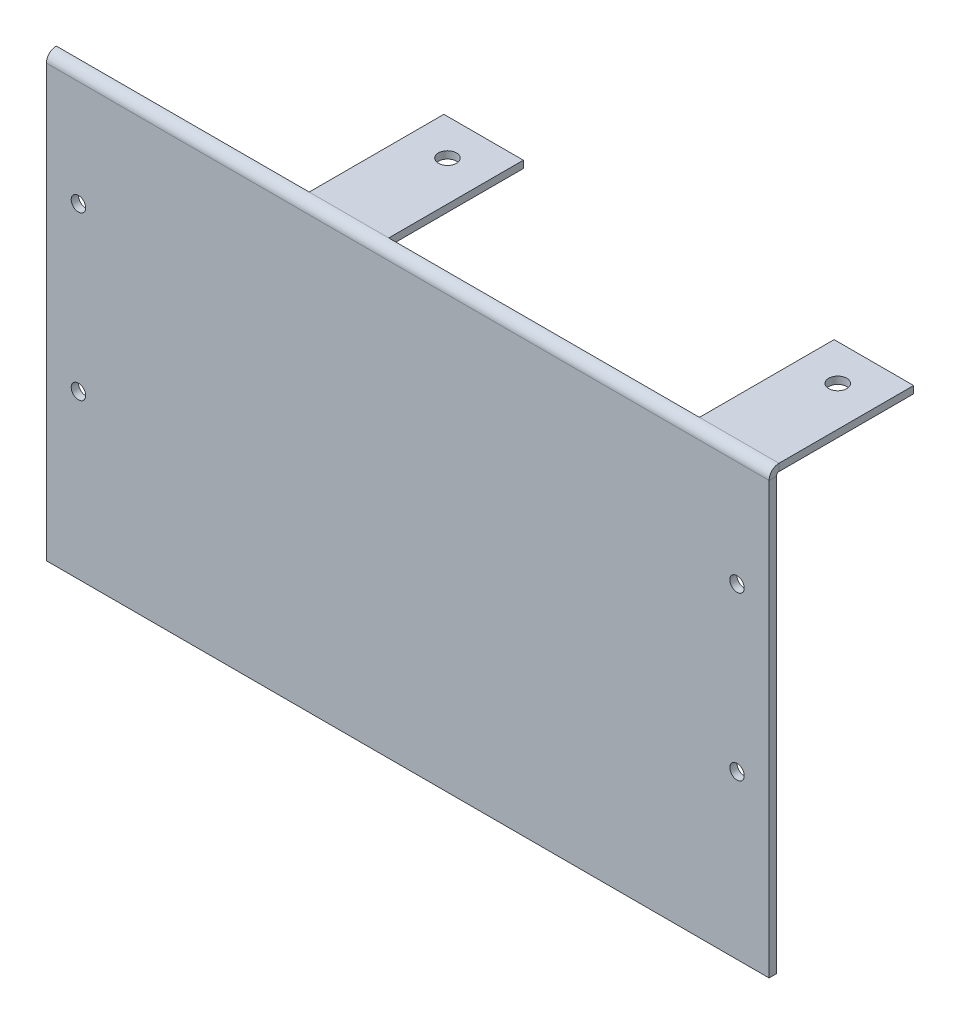
from build123d import *

# Parameters (mm, degrees)
SKETCH2_W                    = 200
SKETCH2_H                    = 120
BASE_FLANGE1_DEPTH           = 2
CUT_EXTRUDE1_REACH           = 235.247
SKETCH7_R                    = 2
EDGE_FLANGE1_STRIP_W         = 9.4732
EDGE_FLANGE1_STRIP_H         = 2
EDGE_FLANGE1_STRIP_CUT_DEPTH = 200
EDGE_FLANGE1_DEPTH           = 200
CUT_EXTRUDE2_REACH           = 239.664
SKETCH11_R                   = 2.5
SKETCH11_W                   = 86
SKETCH11_H                   = 37.2634
SKETCH11_W_2                 = 70


# Sheet-metal steps are written as plain solids
with BuildPart() as part:
    # Sketch2 → Base-Flange1 (new body)
    with BuildSketch(Plane.XY):
        with Locations((100, 60)):
            Rectangle(SKETCH2_W, SKETCH2_H)
    extrude(amount=-BASE_FLANGE1_DEPTH)

    # Sketch7 → Cut-Extrude1 (cut, up to next)
    with BuildSketch(Plane.XY, mode=Mode.PRIVATE) as cut_extrude1_sk1:
        with Locations((8.87, 90)):
            Circle(SKETCH7_R)
    cut_extrude1_tool1 = extrude(cut_extrude1_sk1.sketch, amount=-CUT_EXTRUDE1_REACH, mode=Mode.PRIVATE) & part.part
    # Sketch7 → Cut-Extrude1 (cut, up to next)
    with BuildSketch(Plane.XY, mode=Mode.PRIVATE) as cut_extrude1_sk2:
        with Locations((8.87, 45)):
            Circle(SKETCH7_R)
    cut_extrude1_tool2 = extrude(cut_extrude1_sk2.sketch, amount=-CUT_EXTRUDE1_REACH, mode=Mode.PRIVATE) & part.part
    # Sketch7 → Cut-Extrude1 (cut, up to next)
    with BuildSketch(Plane.XY, mode=Mode.PRIVATE) as cut_extrude1_sk3:
        with Locations((191.13, 45)):
            Circle(SKETCH7_R)
    cut_extrude1_tool3 = extrude(cut_extrude1_sk3.sketch, amount=-CUT_EXTRUDE1_REACH, mode=Mode.PRIVATE) & part.part
    # Sketch7 → Cut-Extrude1 (cut, up to next)
    with BuildSketch(Plane.XY, mode=Mode.PRIVATE) as cut_extrude1_sk4:
        with Locations((191.13, 90)):
            Circle(SKETCH7_R)
    cut_extrude1_tool4 = extrude(cut_extrude1_sk4.sketch, amount=-CUT_EXTRUDE1_REACH, mode=Mode.PRIVATE) & part.part
    add(cut_extrude1_tool1.solids().sort_by_distance((8.87, 90, 0))[0], mode=Mode.SUBTRACT)
    add(cut_extrude1_tool2.solids().sort_by_distance((8.87, 45, 0))[0], mode=Mode.SUBTRACT)
    add(cut_extrude1_tool3.solids().sort_by_distance((191.13, 45, 0))[0], mode=Mode.SUBTRACT)
    add(cut_extrude1_tool4.solids().sort_by_distance((191.13, 90, 0))[0], mode=Mode.SUBTRACT)

    # Edge-Flange1 strip (across the edge) → Edge-Flange1 strip cut (cut)
    with BuildSketch(Plane(origin=(0, 120, -2), x_dir=(0, -1, 0), z_dir=(1, 0, 0))):
        with Locations((-4, -1)):
            Rectangle(EDGE_FLANGE1_STRIP_W, EDGE_FLANGE1_STRIP_H)
    extrude(amount=EDGE_FLANGE1_STRIP_CUT_DEPTH, mode=Mode.SUBTRACT)

    # Edge-Flange1 section (across the edge) → Edge-Flange1 (add)
    with BuildSketch(Plane(origin=(0, 120, -2), x_dir=(0, -1, 0), z_dir=(1, 0, 0))):
        with BuildLine():
            Line((-2, 0.7366), (-2, 38))
            Line((-2, 38), (0, 38))
            Line((0, 38), (0, 0.7366))
            ThreePointArc((0, 0.7366), (0.215745145, 0.215745145), (0.7366, 0))
            Line((0.7366, 0), (0.7366, -2))
            ThreePointArc((0.7366, -2), (-1.198468417, -1.198468417), (-2, 0.7366))
        make_face()
    extrude(amount=EDGE_FLANGE1_DEPTH)

    # Sketch11 → Cut-Extrude2 (cut, up to next)
    with BuildSketch(Plane(origin=(0, 122, 0), x_dir=(1, 0, 0), z_dir=(0, 1, 0)), mode=Mode.PRIVATE) as cut_extrude2_sk1:
        with Locations(Location((189, 30, 0), (0, 0, 270))):
            Circle(SKETCH11_R)
    cut_extrude2_tool1 = extrude(cut_extrude2_sk1.sketch, amount=-CUT_EXTRUDE2_REACH, mode=Mode.PRIVATE) & part.part
    # Sketch11 → Cut-Extrude2 (cut, up to next)
    with BuildSketch(Plane(origin=(0, 122, 0), x_dir=(1, 0, 0), z_dir=(0, 1, 0)), mode=Mode.PRIVATE) as cut_extrude2_sk2:
        with Locations(Location((81, 30, 0), (0, 0, 270))):
            Circle(SKETCH11_R)
    cut_extrude2_tool2 = extrude(cut_extrude2_sk2.sketch, amount=-CUT_EXTRUDE2_REACH, mode=Mode.PRIVATE) & part.part
    # Sketch11 → Cut-Extrude2 (cut, up to next)
    with BuildSketch(Plane(origin=(0, 122, 0), x_dir=(1, 0, 0), z_dir=(0, 1, 0)), mode=Mode.PRIVATE) as cut_extrude2_sk3:
        with Locations((135, 21.3683)):
            Rectangle(SKETCH11_W, SKETCH11_H)
    cut_extrude2_tool3 = extrude(cut_extrude2_sk3.sketch, amount=-CUT_EXTRUDE2_REACH, mode=Mode.PRIVATE) & part.part
    # Sketch11 → Cut-Extrude2 (cut, up to next)
    with BuildSketch(Plane(origin=(0, 122, 0), x_dir=(1, 0, 0), z_dir=(0, 1, 0)), mode=Mode.PRIVATE) as cut_extrude2_sk4:
        with Locations((35, 21.3683)):
            Rectangle(SKETCH11_W_2, SKETCH11_H)
    cut_extrude2_tool4 = extrude(cut_extrude2_sk4.sketch, amount=-CUT_EXTRUDE2_REACH, mode=Mode.PRIVATE) & part.part
    add(cut_extrude2_tool1.solids().sort_by_distance((189, 122, -30))[0], mode=Mode.SUBTRACT)
    add(cut_extrude2_tool2.solids().sort_by_distance((81, 122, -30))[0], mode=Mode.SUBTRACT)
    add(cut_extrude2_tool3.solids().sort_by_distance((135, 122, -21.3683))[0], mode=Mode.SUBTRACT)
    add(cut_extrude2_tool4.solids().sort_by_distance((35, 122, -21.3683))[0], mode=Mode.SUBTRACT)


solid = part.part
